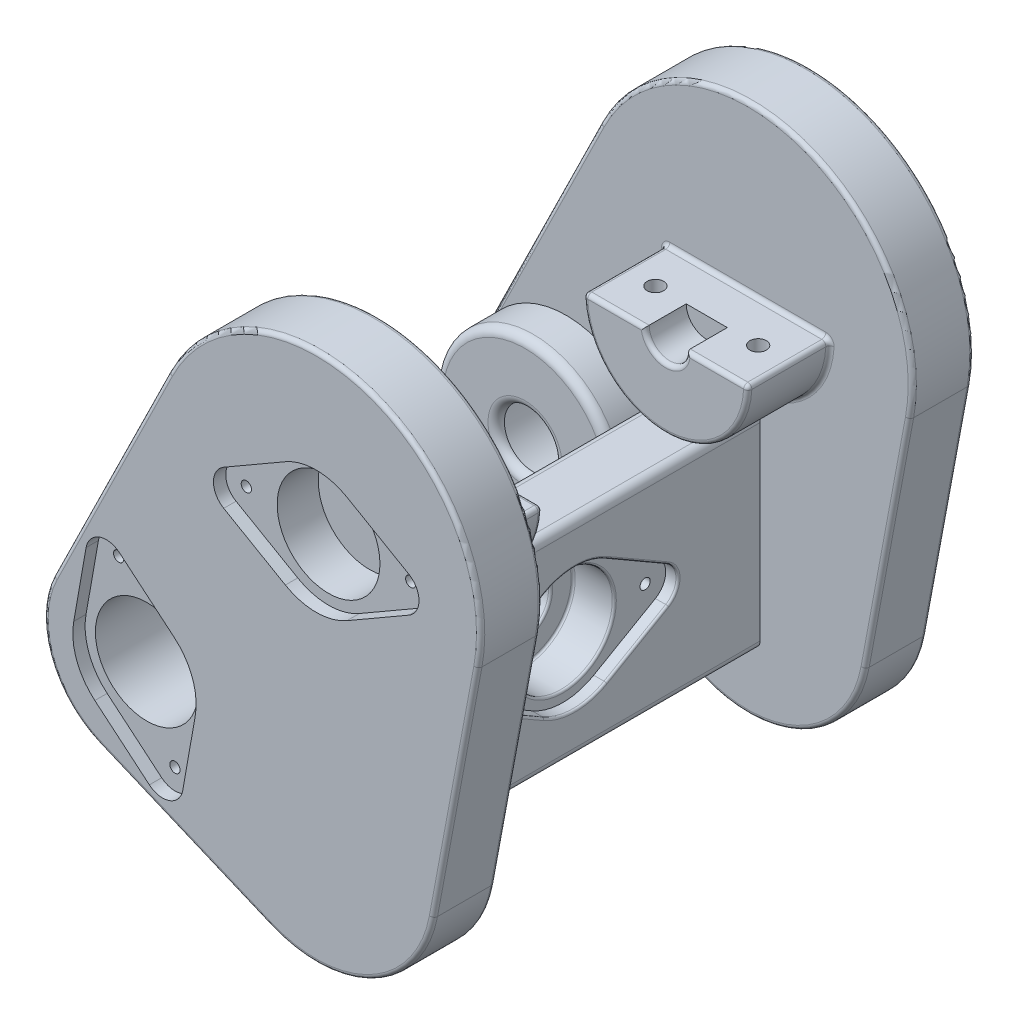
from build123d import *
from build123d.topology import SkipClean

# Parameters (mm, degrees)
SKETCH2_R            = 12.5
BOSS_EXTRUDE1_DEPTH  = 15
SKETCH13_W           = 16
SKETCH13_H           = 50
BOSS_EXTRUDE5_DEPTH  = 45
SKETCH14_R           = 12.5
CUT_EXTRUDE1_DEPTH   = 13
SKETCH15_R           = 1.25
CUT_EXTRUDE2_DEPTH   = 3
SKETCH16_R           = 7
SKETCH16_R_2         = 1.25
CUT_EXTRUDE3_DEPTH   = 116.628716156
FILLET3_R            = 0.5
FILLET4_R            = 0.5
FILLET5_R            = 0.5
BOSS_EXTRUDE7_DEPTH  = 15
BOSS_EXTRUDE8_START  = 10
SKETCH23_R           = 22
SKETCH23_R_2         = 12.5
BOSS_EXTRUDE8_DEPTH  = 10
SKETCH24_R           = 12.5
CUT_EXTRUDE4_DEPTH   = 147.049569685
SKETCH25_R           = 12.5
SKETCH25_R_2         = 7
BOSS_EXTRUDE9_DEPTH  = 2
CUT_EXTRUDE5_DEPTH   = 3
SKETCH27_R           = 1.25
CUT_EXTRUDE6_DEPTH   = 8
SKETCH28_R           = 20
BOSS_EXTRUDE10_DEPTH = 2
BOSS_EXTRUDE11_DEPTH = 20
SKETCH30_R           = 5
CUT_EXTRUDE7_DEPTH   = 10
SKETCH31_R           = 2
CUT_EXTRUDE8_DEPTH   = 12
CUT_EXTRUDE9_DEPTH   = 3
SKETCH33_R           = 1.25
CUT_EXTRUDE10_DEPTH  = 8
FILLET6_R            = 1
FILLET7_R            = 1
FILLET8_R            = 2
FILLET9_R            = 2


# Some blends are built 0.0001 mm under size
with BuildPart() as part:
    # Sketch2 → Boss-Extrude1 (new body)
    with BuildSketch(Plane.XY.offset(60)):
        with BuildLine():
            Line((-39.322032275, -7.333333333), (-28.508473399, -65.316666667))
            ThreePointArc((-28.508473399, -65.316666667), (0, -89), (28.508473399, -65.316666667))
            Line((28.508473399, -65.316666667), (39.322032275, -7.333333333))
            ThreePointArc((39.322032275, -7.333333333), (0, 40), (-39.322032275, -7.333333333))
        make_face()
        Circle(SKETCH2_R, mode=Mode.SUBTRACT)
    boss_extrude1 = extrude(amount=-BOSS_EXTRUDE1_DEPTH)

    # Sketch13 → Boss-Extrude5 (add)
    with BuildSketch(Plane(origin=(0, 0, 45), x_dir=(-1, 0, 0), z_dir=(0, 0, -1))):
        with Locations((5, -49)):
            Rectangle(SKETCH13_W, SKETCH13_H)
    boss_extrude5 = extrude(amount=BOSS_EXTRUDE5_DEPTH)

    # Mirror2: Boss-Extrude5 across plane
    add(boss_extrude5.mirror(Plane.XY))

    # Mirror4: Boss-Extrude1 across plane
    add(boss_extrude1.mirror(Plane.XY))

    # Sketch14 → Cut-Extrude1 (cut)
    with BuildSketch(Plane(origin=(3, 0, 0), x_dir=(0, 0, -1), z_dir=(1, 0, 0))):
        with Locations((0, -49)):
            Circle(SKETCH14_R)
    extrude(amount=-CUT_EXTRUDE1_DEPTH, mode=Mode.SUBTRACT)

    # Sketch15 → Cut-Extrude2 (cut)
    with BuildSketch(Plane(origin=(3, 0, 0), x_dir=(0, 0, -1), z_dir=(1, 0, 0))):
        with BuildLine():
            Line((-22.5, -44.669872981), (-7.5, -36.009618943))
            ThreePointArc((-7.5, -36.009618943), (0, -34), (7.5, -36.009618943))
            Line((7.5, -36.009618943), (22.5, -44.669872981))
            ThreePointArc((22.5, -44.669872981), (25, -49), (22.5, -53.330127019))
            Line((22.5, -53.330127019), (7.5, -61.990381057))
            ThreePointArc((7.5, -61.990381057), (0, -64), (-7.5, -61.990381057))
            Line((-7.5, -61.990381057), (-22.5, -53.330127019))
            ThreePointArc((-22.5, -53.330127019), (-25, -49), (-22.5, -44.669872981))
        make_face()
        with Locations((20, -49)):
            Circle(SKETCH15_R, mode=Mode.SUBTRACT)
        with Locations((-20, -49)):
            Circle(SKETCH15_R, mode=Mode.SUBTRACT)
    extrude(amount=-CUT_EXTRUDE2_DEPTH, mode=Mode.SUBTRACT)

    # Sketch16 → Cut-Extrude3 (cut, through all)
    with BuildSketch(Plane(origin=(3, 0, 0), x_dir=(0, 0, -1), z_dir=(1, 0, 0))):
        with Locations((0, -49)):
            Circle(SKETCH16_R)
        with Locations((20, -49)):
            Circle(SKETCH16_R_2)
        with Locations((-20, -49)):
            Circle(SKETCH16_R_2)
    extrude(amount=-CUT_EXTRUDE3_DEPTH, mode=Mode.SUBTRACT)

    # Fillet3
    fillet3_edges = [part.edges().sort_by_distance(p)[0] for p in [
        (-10, -49, 7),
        (-10, -49, 12.5),
        (0, -49, 12.5),
    ]]
    fillet(fillet3_edges, radius=FILLET3_R)

    # Fillet4
    fillet4_edges = [part.edges().sort_by_distance(p)[0] for p in [
        (-13, -49, 7),
    ]]
    fillet(fillet4_edges, radius=FILLET4_R)

    # Fillet5
    fillet5_edges = [part.edges().sort_by_distance(p)[0] for p in [
        (3, -49, 25),
        (3, -57.660254038, 15),
        (3, -64, 0),
        (3, -57.660254038, -15),
        (3, -49, -25),
        (3, -40.339745962, -15),
        (3, -34, 0),
        (3, -40.339745962, 15),
    ]]
    fillet(fillet5_edges, radius=FILLET5_R)

    # Sketch21 → Boss-Extrude7 (add)
    with BuildSketch(Plane(origin=(0, 0, 45), x_dir=(-1, 0, 0), z_dir=(0, 0, -1))):
        with BuildLine():
            Line((63.949121417, -39.274799426), (35.879526324, 17.682182861))
            ThreePointArc((35.879526324, 17.682182861), (39.626539296, 5.453199377), (39.322032275, -7.333333333))
            Line((39.322032275, -7.333333333), (32.183280175, -45.612002486))
            ThreePointArc((32.183280175, -45.612002486), (45.925459124, -36.617527064), (56.715381939, -49))
            ThreePointArc((56.715381939, -49), (43.626354657, -61.486114162), (31.770894441, -47.823254098))
            Line((31.770894441, -47.823254098), (28.508473399, -65.316666667))
            ThreePointArc((28.508473399, -65.316666667), (22.576057553, -78.202242316), (11.241719496, -86.732447377))
            Line((11.241719496, -86.732447377), (52.743582936, -69.279787666))
            ThreePointArc((52.743582936, -69.279787666), (64.82506776, -56.696807802), (63.949121417, -39.274799426))
        make_face()
        with BuildLine():
            ThreePointArc((39.322032275, -7.333333333), (39.626539296, 5.453199377), (35.879526324, 17.682182861))
            Line((35.879526324, 17.682182861), (11.241719496, -86.732447377))
            ThreePointArc((11.241719496, -86.732447377), (22.576057553, -78.202242316), (28.508473399, -65.316666667))
            Line((28.508473399, -65.316666667), (31.770894441, -47.823254098))
            ThreePointArc((31.770894441, -47.823254098), (31.927246853, -46.708333333), (32.183280175, -45.612002486))
            Line((32.183280175, -45.612002486), (39.322032275, -7.333333333))
        make_face()
    boss_extrude7 = extrude(amount=-BOSS_EXTRUDE7_DEPTH)

    # Sketch23 → Boss-Extrude8 (add)
    with SkipClean():  # the faces are left unmerged after this step: merging them gives an invalid solid
        with BuildSketch(Plane(origin=(0, 0, 45), x_dir=(-1, 0, 0), z_dir=(0, 0, -1)).offset(BOSS_EXTRUDE8_START)):
            with Locations((44.215381939, -49)):
                Circle(SKETCH23_R)
            with Locations((44.215381939, -49)):
                Circle(SKETCH23_R_2, mode=Mode.SUBTRACT)
        boss_extrude8 = extrude(amount=-BOSS_EXTRUDE8_DEPTH)

    # Sketch24 → Cut-Extrude4 (cut, through all)
    with SkipClean():  # the faces are left unmerged after this step: merging them gives an invalid solid
        with BuildSketch(Plane(origin=(0, 0, 35), x_dir=(-1, 0, 0), z_dir=(0, 0, -1))):
            with Locations((44.215381939, -49)):
                Circle(SKETCH24_R)
        cut_extrude4 = extrude(amount=-CUT_EXTRUDE4_DEPTH, mode=Mode.SUBTRACT)
    add(part.part.scale(1), mode=Mode.REPLACE)  # the faces are merged on a copy

    # Sketch25 → Boss-Extrude9 (add)
    with BuildSketch(Plane(origin=(0, 0, 35), x_dir=(-1, 0, 0), z_dir=(0, 0, -1))):
        with Locations((44.215381939, -49)):
            Circle(SKETCH25_R)
        with Locations((44.215381939, -49)):
            Circle(SKETCH25_R_2, mode=Mode.SUBTRACT)
    boss_extrude9 = extrude(amount=-BOSS_EXTRUDE9_DEPTH)

    # Sketch26 → Cut-Extrude5 (cut)
    with BuildSketch(Plane.XY.offset(60)):
        with BuildLine():
            Line((-34.573567794, -37.509333353), (-47.841846757, -26.375925369))
            ThreePointArc((-47.841846757, -26.375925369), (-52.765885522, -25.50768448), (-55.97982357, -29.337906696))
            Line((-55.97982357, -29.337906696), (-58.987498234, -46.395277335))
            ThreePointArc((-58.987498234, -46.395277335), (-58.310771251, -54.13030215), (-53.857196084, -60.490666647))
            Line((-53.857196084, -60.490666647), (-40.588917121, -71.624074631))
            ThreePointArc((-40.588917121, -71.624074631), (-35.664878356, -72.49231552), (-32.450940307, -68.662093304))
            Line((-32.450940307, -68.662093304), (-29.443265644, -51.604722665))
            ThreePointArc((-29.443265644, -51.604722665), (-30.119992627, -43.86969785), (-34.573567794, -37.509333353))
        make_face()
    cut_extrude5 = extrude(amount=-CUT_EXTRUDE5_DEPTH, mode=Mode.SUBTRACT)

    # Sketch27 → Cut-Extrude6 (cut)
    with BuildSketch(Plane.XY.offset(57)):
        with Locations((-51.055784805, -30.206147584)):
            Circle(SKETCH27_R)
        with Locations((-37.374979072, -67.793852416)):
            Circle(SKETCH27_R)
    cut_extrude6 = extrude(amount=-CUT_EXTRUDE6_DEPTH, mode=Mode.SUBTRACT)

    # Mirror12: Boss-Extrude7, Boss-Extrude8, Cut-Extrude4, Boss-Extrude9, Cut-Extrude5, Cut-Extrude6 across plane
    with SkipClean():  # the faces are left unmerged after this step: merging them gives an invalid solid
        add(boss_extrude7.mirror(Plane.XY))
        add(boss_extrude8.mirror(Plane.XY))
        add(cut_extrude4.mirror(Plane.XY), mode=Mode.SUBTRACT)
        add(boss_extrude9.mirror(Plane.XY))
        add(cut_extrude5.mirror(Plane.XY), mode=Mode.SUBTRACT)
        add(cut_extrude6.mirror(Plane.XY), mode=Mode.SUBTRACT)

    # Sketch28 → Boss-Extrude10 (add)
    with SkipClean():  # the faces are left unmerged after this step: merging them gives an invalid solid
        with BuildSketch(Plane(origin=(0, 0, 45), x_dir=(-1, 0, 0), z_dir=(0, 0, -1))):
            Circle(SKETCH28_R)
        boss_extrude10 = extrude(amount=-BOSS_EXTRUDE10_DEPTH)

    # Sketch29 → Boss-Extrude11 (add)
    with SkipClean():  # the faces are left unmerged after this step: merging them gives an invalid solid
        with BuildSketch(Plane(origin=(0, 0, 45), x_dir=(-1, 0, 0), z_dir=(0, 0, -1))):
            with BuildLine():
                Line((-20, 0), (20, 0))
                ThreePointArc((20, 0), (0, -20), (-20, 0))
            make_face()
        boss_extrude11 = extrude(amount=BOSS_EXTRUDE11_DEPTH)

    # Sketch30 → Cut-Extrude7 (cut)
    with SkipClean():  # the faces are left unmerged after this step: merging them gives an invalid solid
        with BuildSketch(Plane(origin=(0, 0, 25), x_dir=(-1, 0, 0), z_dir=(0, 0, -1))):
            Circle(SKETCH30_R)
        cut_extrude7 = extrude(amount=-CUT_EXTRUDE7_DEPTH, mode=Mode.SUBTRACT)

    # Sketch31 → Cut-Extrude8 (cut)
    with SkipClean():  # the faces are left unmerged after this step: merging them gives an invalid solid
        with BuildSketch(Plane(origin=(0, 0, 0), x_dir=(1, 0, 0), z_dir=(0, 1, 0))):
            with Locations(Location((-12.5, -35, 0), (0, 0, 270))):
                Circle(SKETCH31_R)
            with Locations(Location((12.5, -35, 0), (0, 0, 270))):
                Circle(SKETCH31_R)
        cut_extrude8 = extrude(amount=-CUT_EXTRUDE8_DEPTH, mode=Mode.SUBTRACT)

    # Sketch32 → Cut-Extrude9 (cut)
    with SkipClean():  # the faces are left unmerged after this step: merging them gives an invalid solid
        with BuildSketch(Plane(origin=(-30.922387151, 58.307855156, 60), x_dir=(0.34202014332566366, 0.9396926207859102, 0), z_dir=(0, 0, 1))):
            with BuildLine():
                Line((-34.573567794, -37.509333353), (-47.841846757, -26.375925369))
                ThreePointArc((-47.841846757, -26.375925369), (-52.765885522, -25.50768448), (-55.97982357, -29.337906696))
                Line((-55.97982357, -29.337906696), (-58.987498234, -46.395277335))
                ThreePointArc((-58.987498234, -46.395277335), (-58.310771251, -54.13030215), (-53.857196084, -60.490666647))
                Line((-53.857196084, -60.490666647), (-40.588917121, -71.624074631))
                ThreePointArc((-40.588917121, -71.624074631), (-35.664878356, -72.49231552), (-32.450940307, -68.662093304))
                Line((-32.450940307, -68.662093304), (-29.443265644, -51.604722665))
                ThreePointArc((-29.443265644, -51.604722665), (-30.119992627, -43.86969785), (-34.573567794, -37.509333353))
            make_face()
        cut_extrude9 = extrude(amount=-CUT_EXTRUDE9_DEPTH, mode=Mode.SUBTRACT)

    # Sketch33 → Cut-Extrude10 (cut)
    with SkipClean():  # the faces are left unmerged after this step: merging them gives an invalid solid
        with BuildSketch(Plane.XY.offset(57)):
            with Locations((20, 0)):
                Circle(SKETCH33_R)
            with Locations((-20, 0)):
                Circle(SKETCH33_R)
        cut_extrude10 = extrude(amount=-CUT_EXTRUDE10_DEPTH, mode=Mode.SUBTRACT)

    # Mirror13: Boss-Extrude10, Boss-Extrude11, Cut-Extrude7, Cut-Extrude8, Cut-Extrude9, Cut-Extrude10 across plane
    with SkipClean():  # the faces are left unmerged after this step: merging them gives an invalid solid
        add(boss_extrude10.mirror(Plane.XY))
        add(boss_extrude11.mirror(Plane.XY))
        add(cut_extrude7.mirror(Plane.XY), mode=Mode.SUBTRACT)
        add(cut_extrude8.mirror(Plane.XY), mode=Mode.SUBTRACT)
        add(cut_extrude9.mirror(Plane.XY), mode=Mode.SUBTRACT)
        add(cut_extrude10.mirror(Plane.XY), mode=Mode.SUBTRACT)

    # Fillet6
    # the kernel refuses this fillet: 1 mm, written as the material it takes off along each edge
    with BuildSketch(Plane(origin=(0, -60, 60), x_dir=(-0.38764549985050817, -0.9218085302521613, 0), z_dir=(-0.9218085302521613, 0.38764549985050817, 0))) as fillet6_piece_1:
        with BuildLine():
            CenterArc((29 - FILLET6_R, -FILLET6_R), FILLET6_R, 0, 90)
            Line((29 - FILLET6_R, 0), (29, 0))
            Line((29, 0), (29, -FILLET6_R))
        make_face()
    revolve(axis=Axis((0, -60, 60), (0, 0, 1)), revolution_arc=102.244097048, mode=Mode.SUBTRACT)
    with BuildSketch(Plane(origin=(0, -60, 45), x_dir=(-0.38764549985050817, -0.9218085302521613, 0), z_dir=(-0.9218085302521613, 0.38764549985050817, 0))) as fillet6_piece_2:
        with BuildLine():
            CenterArc((29 - FILLET6_R, FILLET6_R), FILLET6_R, 270, 90)
            Line((29, FILLET6_R), (29, 0))
            Line((29, 0), (29 - FILLET6_R, 0))
        make_face()
    revolve(axis=Axis((0, -60, 45), (0, 0, 1)), revolution_arc=102.244097048, mode=Mode.SUBTRACT)
    with BuildSketch(Plane(origin=(-63.949121417, -39.274799426, 60), x_dir=(0, 0, -1), z_dir=(0.4420545715370929, 0.8969881581064252, 0))) as fillet6_piece_3:
        with BuildLine():
            CenterArc((FILLET6_R, -FILLET6_R), FILLET6_R, 90, 90)
            Line((0, -FILLET6_R), (0, 0))
            Line((0, 0), (FILLET6_R, 0))
        make_face()
    extrude(amount=63.498031466, mode=Mode.SUBTRACT)
    with BuildSketch(Plane(origin=(-11.241719496, -86.732447377, 45), x_dir=(0.38764549985050845, 0.9218085302521613, 0), z_dir=(-0.9218085302521611, 0.38764549985050845, 0))) as fillet6_piece_4_section:
        with BuildLine():
            CenterArc((FILLET6_R, -FILLET6_R), FILLET6_R, 90, 90)
            Line((0, -FILLET6_R), (0, 0))
            Line((0, 0), (FILLET6_R, 0))
        make_face()
    fillet6_piece_4 = extrude(amount=52.522216738, mode=Mode.PRIVATE)
    fillet6_piece_4 = fillet6_piece_4 - Plane(origin=(-44.215381939, -49, 45), x_dir=(-1, 0, 0), z_dir=(0, 0, -1)) * Cylinder(22, 110, mode=Mode.PRIVATE)
    add(fillet6_piece_4, mode=Mode.SUBTRACT)
    with BuildSketch(Plane(origin=(-44.215381939, -49, 60), x_dir=(-0.3876454998505073, -0.9218085302521616, 0), z_dir=(0.9218085302521616, -0.3876454998505073, 0))) as fillet6_piece_5:
        with BuildLine():
            CenterArc((22 - FILLET6_R, FILLET6_R), FILLET6_R, 270, 90)
            Line((22 - FILLET6_R, 0), (22, 0))
            Line((22, 0), (22, FILLET6_R))
        make_face()
    revolve(axis=Axis((-44.215381939, -49, 60), (0, 0, -1)), revolution_arc=93.426969898, mode=Mode.SUBTRACT)
    with BuildSketch(Plane(origin=(-11.241719496, -86.732447377, 60), x_dir=(0, 0, -1), z_dir=(-0.9218085302521611, 0.38764549985050845, 0))) as fillet6_piece_6:
        with BuildLine():
            CenterArc((FILLET6_R, -FILLET6_R), FILLET6_R, 90, 90)
            Line((0, -FILLET6_R), (0, 0))
            Line((0, 0), (FILLET6_R, 0))
        make_face()
    extrude(amount=45.022216738, mode=Mode.SUBTRACT)
    with BuildSketch(Plane(origin=(-67.264530704, -46.002210612, 45), x_dir=(0.8969881581064253, -0.4420545715370929, 0), z_dir=(0.4420545715370929, 0.8969881581064252, 0))) as fillet6_piece_7_section:
        with BuildLine():
            CenterArc((FILLET6_R, -FILLET6_R), FILLET6_R, 90, 90)
            Line((0, -FILLET6_R), (0, 0))
            Line((0, 0), (FILLET6_R, 0))
        make_face()
    fillet6_piece_7 = extrude(amount=70.998031466, mode=Mode.PRIVATE)
    fillet6_piece_7 = fillet6_piece_7 - Plane(origin=(-44.215381939, -49, 45), x_dir=(-1, 0, 0), z_dir=(0, 0, -1)) * Cylinder(22, 146, mode=Mode.PRIVATE)
    add(fillet6_piece_7, mode=Mode.SUBTRACT)
    with BuildSketch(Plane(origin=(28.508473399, -65.316666667, 45), x_dir=(-0.9830508068705752, 0.18333333333333338, 0), z_dir=(0.1833333333333334, 0.9830508068705752, 0)), Plane(origin=(28.508473399, -65.316666667, 60), x_dir=(0, 0, -1), z_dir=(0.1833333333333334, 0.9830508068705752, 0))) as fillet6_piece_8:
        with BuildLine():
            CenterArc((FILLET6_R, FILLET6_R), FILLET6_R, 180, 90)
            Line((0, FILLET6_R), (0, 0))
            Line((0, 0), (FILLET6_R, 0))
        make_face()
    extrude(amount=58.983048412, mode=Mode.SUBTRACT)
    with BuildSketch(Plane(origin=(0, -60, -60), x_dir=(-0.38764549985050817, -0.9218085302521613, 0), z_dir=(-0.9218085302521613, 0.38764549985050817, 0))) as fillet6_piece_9:
        with BuildLine():
            CenterArc((29 - FILLET6_R, FILLET6_R), FILLET6_R, 270, 90)
            Line((29 - FILLET6_R, 0), (29, 0))
            Line((29, 0), (29, FILLET6_R))
        make_face()
    revolve(axis=Axis((0, -60, -60), (0, 0, 1)), revolution_arc=102.244097048, mode=Mode.SUBTRACT)
    with BuildSketch(Plane(origin=(0, -60, -45), x_dir=(-0.38764549985050817, -0.9218085302521613, 0), z_dir=(-0.9218085302521613, 0.38764549985050817, 0))) as fillet6_piece_10:
        with BuildLine():
            CenterArc((29 - FILLET6_R, -FILLET6_R), FILLET6_R, 0, 90)
            Line((29, -FILLET6_R), (29, 0))
            Line((29, 0), (29 - FILLET6_R, 0))
        make_face()
    revolve(axis=Axis((0, -60, -45), (0, 0, 1)), revolution_arc=102.244097048, mode=Mode.SUBTRACT)
    with BuildSketch(Plane(origin=(-11.241719496, -86.732447377, -60), x_dir=(0, 0, 1), z_dir=(-0.9218085302521611, 0.38764549985050845, 0))) as fillet6_piece_11:
        with BuildLine():
            CenterArc((FILLET6_R, FILLET6_R), FILLET6_R, 180, 90)
            Line((0, FILLET6_R), (0, 0))
            Line((0, 0), (FILLET6_R, 0))
        make_face()
    extrude(amount=45.022216738, mode=Mode.SUBTRACT)
    with BuildSketch(Plane(origin=(-44.215381939, -49, -60), x_dir=(-0.3876454998505073, -0.9218085302521616, 0), z_dir=(0.9218085302521616, -0.3876454998505073, 0))) as fillet6_piece_12:
        with BuildLine():
            CenterArc((22 - FILLET6_R, -FILLET6_R), FILLET6_R, 0, 90)
            Line((22 - FILLET6_R, 0), (22, 0))
            Line((22, 0), (22, -FILLET6_R))
        make_face()
    revolve(axis=Axis((-44.215381939, -49, -60), (0, 0, -1)), revolution_arc=93.426969898, mode=Mode.SUBTRACT)
    with BuildSketch(Plane(origin=(-67.264530704, -46.002210612, -45), x_dir=(0.8969881581064253, -0.4420545715370929, 0), z_dir=(0.4420545715370929, 0.8969881581064252, 0))) as fillet6_piece_13_section:
        with BuildLine():
            CenterArc((FILLET6_R, FILLET6_R), FILLET6_R, 180, 90)
            Line((0, FILLET6_R), (0, 0))
            Line((0, 0), (FILLET6_R, 0))
        make_face()
    fillet6_piece_13 = extrude(amount=70.998031466, mode=Mode.PRIVATE)
    fillet6_piece_13 = fillet6_piece_13 - Plane(origin=(-44.215381939, -49, -45), x_dir=(-1, 0, 0), z_dir=(0, 0, 1)) * Cylinder(22, 146, mode=Mode.PRIVATE)
    add(fillet6_piece_13, mode=Mode.SUBTRACT)
    with BuildSketch(Plane(origin=(-63.949121417, -39.274799426, -60), x_dir=(0, 0, 1), z_dir=(0.4420545715370929, 0.8969881581064252, 0))) as fillet6_piece_14:
        with BuildLine():
            CenterArc((FILLET6_R, FILLET6_R), FILLET6_R, 180, 90)
            Line((0, FILLET6_R), (0, 0))
            Line((0, 0), (FILLET6_R, 0))
        make_face()
    extrude(amount=63.498031466, mode=Mode.SUBTRACT)
    with BuildSketch(Plane(origin=(-11.241719496, -86.732447377, -45), x_dir=(0.38764549985050845, 0.9218085302521613, 0), z_dir=(-0.9218085302521611, 0.38764549985050845, 0))) as fillet6_piece_15_section:
        with BuildLine():
            CenterArc((FILLET6_R, FILLET6_R), FILLET6_R, 180, 90)
            Line((0, FILLET6_R), (0, 0))
            Line((0, 0), (FILLET6_R, 0))
        make_face()
    fillet6_piece_15 = extrude(amount=52.522216738, mode=Mode.PRIVATE)
    fillet6_piece_15 = fillet6_piece_15 - Plane(origin=(-44.215381939, -49, -45), x_dir=(-1, 0, 0), z_dir=(0, 0, 1)) * Cylinder(22, 110, mode=Mode.PRIVATE)
    add(fillet6_piece_15, mode=Mode.SUBTRACT)
    with BuildSketch(Plane(origin=(0, 0, -45), x_dir=(0.9830508068705752, -0.18333333333333324, 0), z_dir=(-0.18333333333333324, -0.9830508068705752, 0))) as fillet6_piece_16:
        with BuildLine():
            CenterArc((40 - FILLET6_R, -FILLET6_R), FILLET6_R, 0, 90)
            Line((40, -FILLET6_R), (40, 0))
            Line((40, 0), (40 - FILLET6_R, 0))
        make_face()
    revolve(axis=Axis((0, 0, -45), (0, 0, 1)), revolution_arc=164.328933054, mode=Mode.SUBTRACT)
    with BuildSketch(Plane(origin=(28.508473399, -65.316666667, -45), x_dir=(-0.9830508068705752, 0.18333333333333338, 0), z_dir=(0.1833333333333334, 0.9830508068705752, 0)), Plane(origin=(28.508473399, -65.316666667, -60), x_dir=(0, 0, 1), z_dir=(0.1833333333333334, 0.9830508068705752, 0))) as fillet6_piece_17:
        with BuildLine():
            CenterArc((FILLET6_R, -FILLET6_R), FILLET6_R, 90, 90)
            Line((0, -FILLET6_R), (0, 0))
            Line((0, 0), (FILLET6_R, 0))
        make_face()
    extrude(amount=58.983048412, mode=Mode.SUBTRACT)
    with BuildSketch(Plane(origin=(0, 0, -60), x_dir=(0.9830508068705752, -0.18333333333333324, 0), z_dir=(-0.18333333333333324, -0.9830508068705752, 0))) as fillet6_piece_18:
        with BuildLine():
            CenterArc((40 - FILLET6_R, FILLET6_R), FILLET6_R, 270, 90)
            Line((40 - FILLET6_R, 0), (40, 0))
            Line((40, 0), (40, FILLET6_R))
        make_face()
    revolve(axis=Axis((0, 0, -60), (0, 0, 1)), revolution_arc=164.328933054, mode=Mode.SUBTRACT)
    with BuildSketch(Plane(origin=(0, 0, 45), x_dir=(0.9830508068705752, -0.18333333333333324, 0), z_dir=(-0.18333333333333324, -0.9830508068705752, 0))) as fillet6_piece_19:
        with BuildLine():
            CenterArc((40 - FILLET6_R, FILLET6_R), FILLET6_R, 270, 90)
            Line((40, FILLET6_R), (40, 0))
            Line((40, 0), (40 - FILLET6_R, 0))
        make_face()
    revolve(axis=Axis((0, 0, 45), (0, 0, 1)), revolution_arc=164.328933054, mode=Mode.SUBTRACT)
    with BuildSketch(Plane(origin=(0, 0, 60), x_dir=(0.9830508068705752, -0.18333333333333324, 0), z_dir=(-0.18333333333333324, -0.9830508068705752, 0))) as fillet6_piece_20:
        with BuildLine():
            CenterArc((40 - FILLET6_R, -FILLET6_R), FILLET6_R, 0, 90)
            Line((40 - FILLET6_R, 0), (40, 0))
            Line((40, 0), (40, -FILLET6_R))
        make_face()
    revolve(axis=Axis((0, 0, 60), (0, 0, 1)), revolution_arc=164.328933054, mode=Mode.SUBTRACT)

    # Fillet7
    fillet7_edges = [part.edges().sort_by_distance(p)[0] for p in [
        (0, -20, 45),
        (20, 0, 35),
        (0, 0, 45),
        (-20, 0, 35),
        (0, -20, 25),
        (-12.5, 0, 25),
        (12.5, 0, 25),
        (0, -5, 25),
        (0, -20, -25),
        (-20, 0, -35),
        (-12.5, 0, -25),
        (20, 0, -35),
        (0, -20, -45),
        (0, 0, -45),
        (12.5, 0, -25),
        (0, -5, -25),
    ]]
    fillet(fillet7_edges, radius=FILLET7_R)

    # Fillet8
    fillet8_edges = [part.edges().sort_by_distance(p)[0] for p in [
        (-13, -24, 0),
        (-13, -74, 0),
        (3, -74, 0),
        (3, -24, 0),
    ]]
    fillet(fillet8_edges, radius=FILLET8_R)

    # Fillet9
    fillet9_edges = [part.edges().sort_by_distance(p)[0] for p in [
        (-22.215381939, -49, 35),
        (-37.215381939, -49, 35),
        (-22.215381939, -49, -35),
        (-37.215381939, -49, -35),
    ]]
    fillet(fillet9_edges, radius=FILLET9_R - 0.0001)  # a hair under: the kernel refuses the full size


solid = part.part
